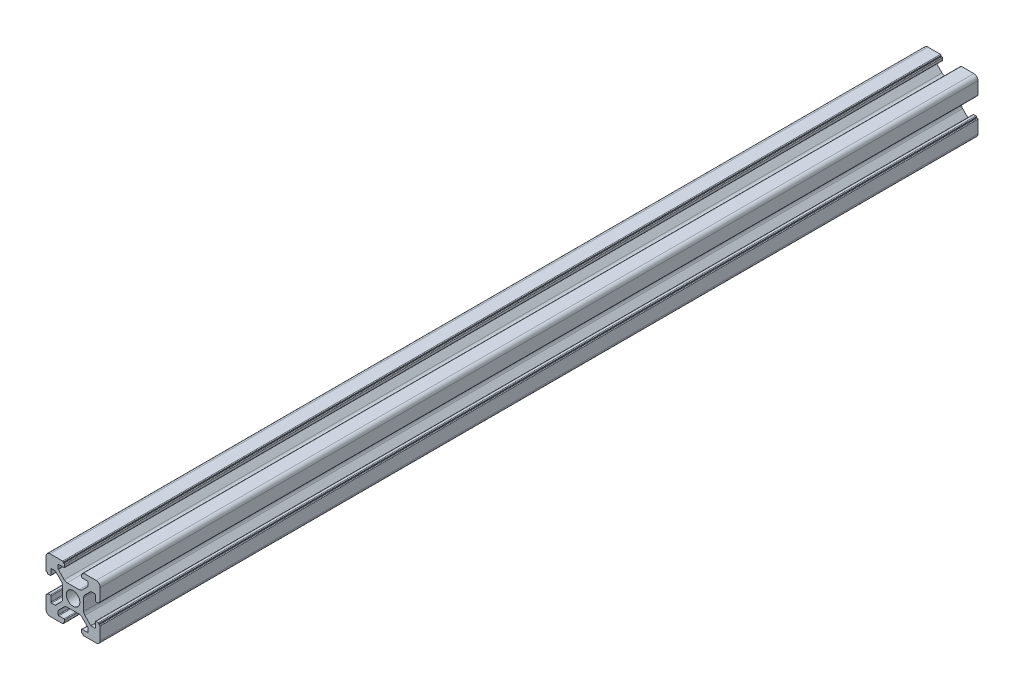
from build123d import *

# Parameters (mm, degrees)
SKETCH_1_R      = 2.5
EXTRUDE_1_DEPTH = 324


with BuildPart() as part:
    # 草图1 → 凸台-拉伸1 (new body)
    with BuildSketch(Plane.XY):
        with BuildLine():
            ThreePointArc((-10.002261885, -8.502261885), (-9.562922057, -9.562922057), (-8.502261885, -10.002261885))
            Line((-8.502261885, -10.002261885), (-3.85, -10.002261885))
            ThreePointArc((-3.85, -10.002261885), (-3.673223305, -9.929038581), (-3.6, -9.752261885))
            Line((-3.6, -9.752261885), (-3.6, -9.502261885))
            Line((-3.6, -9.502261885), (-3.35, -9.502261885))
            ThreePointArc((-3.35, -9.502261885), (-3.173223305, -9.429038581), (-3.1, -9.252261885))
            Line((-3.1, -9.252261885), (-3.1, -8.45))
            ThreePointArc((-3.1, -8.45), (-3.173223305, -8.273223305), (-3.35, -8.2))
            Line((-3.35, -8.2), (-5.25, -8.2))
            ThreePointArc((-5.25, -8.2), (-5.426776695, -8.126776695), (-5.5, -7.95))
            Line((-5.5, -7.95), (-5.5, -6.664213562))
            ThreePointArc((-5.5, -6.664213562), (-5.480969883, -6.568542704), (-5.426776695, -6.487436867))
            Line((-5.426776695, -6.487436867), (-3.278679656, -4.339339828))
            ThreePointArc((-3.278679656, -4.339339828), (-2.792044633, -4.014180701), (-2.218019485, -3.9))
            Line((-2.218019485, -3.9), (2.218019485, -3.9))
            ThreePointArc((2.218019485, -3.9), (2.792044633, -4.014180701), (3.278679656, -4.339339828))
            Line((3.278679656, -4.339339828), (5.426776695, -6.487436867))
            ThreePointArc((5.426776695, -6.487436867), (5.480969883, -6.568542704), (5.5, -6.664213562))
            Line((5.5, -6.664213562), (5.5, -7.95))
            ThreePointArc((5.5, -7.95), (5.426776695, -8.126776695), (5.25, -8.2))
            Line((5.25, -8.2), (3.35, -8.2))
            ThreePointArc((3.35, -8.2), (3.173223305, -8.273223305), (3.1, -8.45))
            Line((3.1, -8.45), (3.1, -9.252261885))
            ThreePointArc((3.1, -9.252261885), (3.173223305, -9.429038581), (3.35, -9.502261885))
            Line((3.35, -9.502261885), (3.6, -9.502261885))
            Line((3.6, -9.502261885), (3.6, -9.752261885))
            ThreePointArc((3.6, -9.752261885), (3.673223305, -9.929038581), (3.85, -10.002261885))
            Line((3.85, -10.002261885), (8.502261885, -10.002261885))
            ThreePointArc((8.502261885, -10.002261885), (9.562922057, -9.562922057), (10.002261885, -8.502261885))
            Line((10.002261885, -8.502261885), (10.002261885, -3.85))
            ThreePointArc((10.002261885, -3.85), (9.929038581, -3.673223305), (9.752261885, -3.6))
            Line((9.752261885, -3.6), (9.502261885, -3.6))
            Line((9.502261885, -3.6), (9.502261885, -3.35))
            ThreePointArc((9.502261885, -3.35), (9.429038581, -3.173223305), (9.252261885, -3.1))
            Line((9.252261885, -3.1), (8.45, -3.1))
            ThreePointArc((8.45, -3.1), (8.273223305, -3.173223305), (8.2, -3.35))
            Line((8.2, -3.35), (8.2, -5.25))
            ThreePointArc((8.2, -5.25), (8.126776695, -5.426776695), (7.95, -5.5))
            Line((7.95, -5.5), (6.664213562, -5.5))
            ThreePointArc((6.664213562, -5.5), (6.568542704, -5.480969883), (6.487436867, -5.426776695))
            Line((6.487436867, -5.426776695), (4.339339828, -3.278679656))
            ThreePointArc((4.339339828, -3.278679656), (4.014180701, -2.792044633), (3.9, -2.218019485))
            Line((3.9, -2.218019485), (3.9, 2.218019485))
            ThreePointArc((3.9, 2.218019485), (4.014180701, 2.792044633), (4.339339828, 3.278679656))
            Line((4.339339828, 3.278679656), (6.487436867, 5.426776695))
            ThreePointArc((6.487436867, 5.426776695), (6.568542704, 5.480969883), (6.664213562, 5.5))
            Line((6.664213562, 5.5), (7.95, 5.5))
            ThreePointArc((7.95, 5.5), (8.126776695, 5.426776695), (8.2, 5.25))
            Line((8.2, 5.25), (8.2, 3.35))
            ThreePointArc((8.2, 3.35), (8.273223305, 3.173223305), (8.45, 3.1))
            Line((8.45, 3.1), (9.252261885, 3.1))
            ThreePointArc((9.252261885, 3.1), (9.429038581, 3.173223305), (9.502261885, 3.35))
            Line((9.502261885, 3.35), (9.502261885, 3.6))
            Line((9.502261885, 3.6), (9.752261885, 3.6))
            ThreePointArc((9.752261885, 3.6), (9.929038581, 3.673223305), (10.002261885, 3.85))
            Line((10.002261885, 3.85), (10.002261885, 8.502261885))
            ThreePointArc((10.002261885, 8.502261885), (9.562922057, 9.562922057), (8.502261885, 10.002261885))
            Line((8.502261885, 10.002261885), (3.85, 10.002261885))
            ThreePointArc((3.85, 10.002261885), (3.673223305, 9.929038581), (3.6, 9.752261885))
            Line((3.6, 9.752261885), (3.6, 9.502261885))
            Line((3.6, 9.502261885), (3.35, 9.502261885))
            ThreePointArc((3.35, 9.502261885), (3.173223305, 9.429038581), (3.1, 9.252261885))
            Line((3.1, 9.252261885), (3.1, 8.45))
            ThreePointArc((3.1, 8.45), (3.173223305, 8.273223305), (3.35, 8.2))
            Line((3.35, 8.2), (5.25, 8.2))
            ThreePointArc((5.25, 8.2), (5.426776695, 8.126776695), (5.5, 7.95))
            Line((5.5, 7.95), (5.5, 6.664213562))
            ThreePointArc((5.5, 6.664213562), (5.480969883, 6.568542704), (5.426776695, 6.487436867))
            Line((5.426776695, 6.487436867), (3.278679656, 4.339339828))
            ThreePointArc((3.278679656, 4.339339828), (2.792044633, 4.014180701), (2.218019485, 3.9))
            Line((2.218019485, 3.9), (-2.218019485, 3.9))
            ThreePointArc((-2.218019485, 3.9), (-2.792044633, 4.014180701), (-3.278679656, 4.339339828))
            Line((-3.278679656, 4.339339828), (-5.426776695, 6.487436867))
            ThreePointArc((-5.426776695, 6.487436867), (-5.480969883, 6.568542704), (-5.5, 6.664213562))
            Line((-5.5, 6.664213562), (-5.5, 7.95))
            ThreePointArc((-5.5, 7.95), (-5.426776695, 8.126776695), (-5.25, 8.2))
            Line((-5.25, 8.2), (-3.35, 8.2))
            ThreePointArc((-3.35, 8.2), (-3.173223305, 8.273223305), (-3.1, 8.45))
            Line((-3.1, 8.45), (-3.1, 9.252261885))
            ThreePointArc((-3.1, 9.252261885), (-3.173223305, 9.429038581), (-3.35, 9.502261885))
            Line((-3.35, 9.502261885), (-3.6, 9.502261885))
            Line((-3.6, 9.502261885), (-3.6, 9.752261885))
            ThreePointArc((-3.6, 9.752261885), (-3.673223305, 9.929038581), (-3.85, 10.002261885))
            Line((-3.85, 10.002261885), (-8.502261885, 10.002261885))
            ThreePointArc((-8.502261885, 10.002261885), (-9.562922057, 9.562922057), (-10.002261885, 8.502261885))
            Line((-10.002261885, 8.502261885), (-10.002261885, 3.85))
            ThreePointArc((-10.002261885, 3.85), (-9.929038581, 3.673223305), (-9.752261885, 3.6))
            Line((-9.752261885, 3.6), (-9.502261885, 3.6))
            Line((-9.502261885, 3.6), (-9.502261885, 3.35))
            ThreePointArc((-9.502261885, 3.35), (-9.429038581, 3.173223305), (-9.252261885, 3.1))
            Line((-9.252261885, 3.1), (-8.45, 3.1))
            ThreePointArc((-8.45, 3.1), (-8.273223305, 3.173223305), (-8.2, 3.35))
            Line((-8.2, 3.35), (-8.2, 5.25))
            ThreePointArc((-8.2, 5.25), (-8.126776695, 5.426776695), (-7.95, 5.5))
            Line((-7.95, 5.5), (-6.664213562, 5.5))
            ThreePointArc((-6.664213562, 5.5), (-6.568542704, 5.480969883), (-6.487436867, 5.426776695))
            Line((-6.487436867, 5.426776695), (-4.339339828, 3.278679656))
            ThreePointArc((-4.339339828, 3.278679656), (-4.014180701, 2.792044633), (-3.9, 2.218019485))
            Line((-3.9, 2.218019485), (-3.9, -2.218019485))
            ThreePointArc((-3.9, -2.218019485), (-4.014180701, -2.792044633), (-4.339339828, -3.278679656))
            Line((-4.339339828, -3.278679656), (-6.487436867, -5.426776695))
            ThreePointArc((-6.487436867, -5.426776695), (-6.568542704, -5.480969883), (-6.664213562, -5.5))
            Line((-6.664213562, -5.5), (-7.95, -5.5))
            ThreePointArc((-7.95, -5.5), (-8.126776695, -5.426776695), (-8.2, -5.25))
            Line((-8.2, -5.25), (-8.2, -3.35))
            ThreePointArc((-8.2, -3.35), (-8.273223305, -3.173223305), (-8.45, -3.1))
            Line((-8.45, -3.1), (-9.252261885, -3.1))
            ThreePointArc((-9.252261885, -3.1), (-9.429038581, -3.173223305), (-9.502261885, -3.35))
            Line((-9.502261885, -3.35), (-9.502261885, -3.6))
            Line((-9.502261885, -3.6), (-9.752261885, -3.6))
            ThreePointArc((-9.752261885, -3.6), (-9.929038581, -3.673223305), (-10.002261885, -3.85))
            Line((-10.002261885, -3.85), (-10.002261885, -8.502261885))
        make_face()
        Circle(SKETCH_1_R, mode=Mode.SUBTRACT)
    extrude(amount=EXTRUDE_1_DEPTH)


solid = part.part
